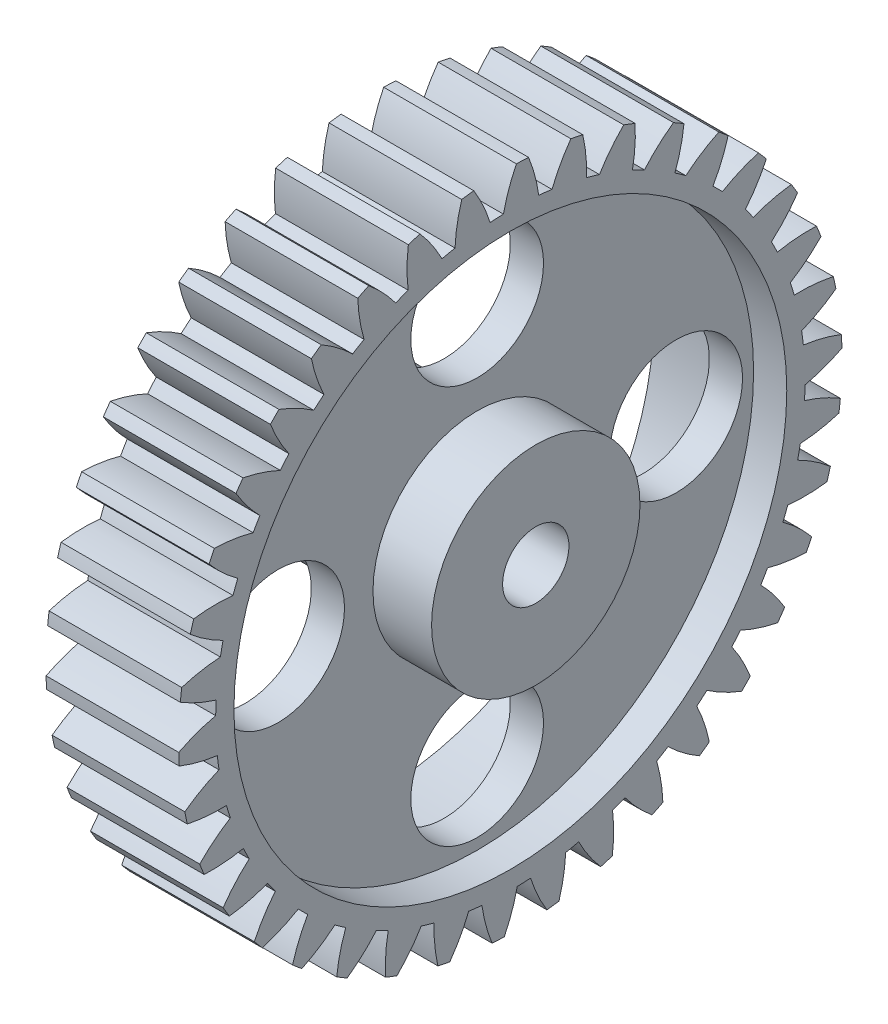
from build123d import *

# Parameters (mm, degrees)
SKETCH1_R                = 6
SKETCH1_R_2              = 3
BOSS_EXTRUDE1_DEPTH      = 12
BOSS_EXTRUDE2_DEPTH      = 2.3
BOSS_EXTRUDE2_DEPTH_BACK = 3
SKETCH2_R                = 9.425
SKETCH2_R_2              = 3
BOSS_EXTRUDE3_DEPTH      = 8.3
BOSS_EXTRUDE3_DEPTH_BACK = 6
SKETCH3_R                = 7.325
SKETCH3_R_2              = 3
CUT_EXTRUDE1_START       = -3
SKETCH4_R                = 25
SKETCH4_R_2              = 9.425
CUT_EXTRUDE1_DEPTH       = 3
SKETCH5_R                = 25
SKETCH5_R_2              = 7.325
CUT_EXTRUDE2_DEPTH       = 6


with BuildPart() as part:
    # Sketch1 → Boss-Extrude1 (new body)
    with BuildSketch(Plane(origin=(0, 0, 0), x_dir=(0, 0, -1), z_dir=(1, 0, 0))):
        with BuildLine():
            ThreePointArc((0.545834956, 29.995033992), (-0.144682898, 28.355188049), (-0.62738395, 26.642614162))
            ThreePointArc((-0.62738395, 26.642614162), (-1.229291333, 26.621632986), (-1.830570879, 26.587055314))
            ThreePointArc((-1.830570879, 26.587055314), (-2.469042312, 28.247857485), (-3.307743856, 29.817089573))
            ThreePointArc((-3.307743856, 29.817089573), (-3.853834567, 29.751436253), (-4.398629852, 29.675782305))
            ThreePointArc((-4.398629852, 29.675782305), (-4.809820172, 27.94464622), (-5.004057412, 26.175979627))
            ThreePointArc((-5.004057412, 26.175979627), (-5.594302175, 26.056213907), (-6.181689754, 25.923140469))
            ThreePointArc((-6.181689754, 25.923140469), (-7.084812322, 27.45620252), (-8.170362183, 28.86598659))
            ThreePointArc((-8.170362183, 28.86598659), (-8.698198747, 28.711345119), (-9.223111504, 28.547052636))
            ThreePointArc((-9.223111504, 28.547052636), (-9.343758089, 26.771847288), (-9.244233233, 24.995332603))
            ThreePointArc((-9.244233233, 24.995332603), (-9.806715037, 24.780049237), (-10.364188247, 24.552109929))
            ThreePointArc((-10.364188247, 24.552109929), (-11.507327121, 25.915613923), (-12.810114328, 27.127494741))
            ThreePointArc((-12.810114328, 27.127494741), (-13.305298739, 26.888083335), (-13.796010717, 26.639633787))
            ThreePointArc((-13.796010717, 26.639633787), (-13.622822643, 24.868782151), (-13.23225047, 23.132878064))
            ThreePointArc((-13.23225047, 23.132878064), (-13.751626278, 22.82794942), (-14.263978703, 22.511361833))
            ThreePointArc((-14.263978703, 22.511361833), (-15.615952033, 23.668114934), (-17.100439947, 24.649035551))
            ThreePointArc((-17.100439947, 24.649035551), (-17.549464867, 24.33138473), (-17.992590721, 24.005555173))
            ThreePointArc((-17.992590721, 24.005555173), (-17.530292107, 22.287361466), (-16.859326407, 20.639418914))
            ThreePointArc((-16.859326407, 20.639418914), (-17.321429001, 20.253162651), (-17.774685002, 19.856562469))
            ThreePointArc((-17.774685002, 19.856562469), (-19.298614482, 20.775011469), (-20.924310142, 21.498214927))
            ThreePointArc((-20.924310142, 21.498214927), (-21.314927341, 21.110989377), (-21.698379753, 20.716667591))
            ThreePointArc((-21.698379753, 20.716667591), (-20.9595809, 19.097999658), (-20.026523869, 17.582970219))
            ThreePointArc((-20.026523869, 17.582970219), (-20.418748294, 17.125922401), (-20.80054423, 16.660127842))
            ThreePointArc((-20.80054423, 16.660127842), (-22.454861035, 17.315219847), (-24.177419703, 17.760979042))
            ThreePointArc((-24.177419703, 17.760979042), (-24.498974161, 17.314741265), (-24.812293549, 16.862683322))
            ThreePointArc((-24.812293549, 16.862683322), (-23.817146964, 15.387694204), (-22.647449965, 14.046903932))
            ThreePointArc((-22.647449965, 14.046903932), (-22.959097362, 13.531531632), (-23.259018835, 13.009248358))
            ThreePointArc((-23.259018835, 13.009248358), (-24.998597514, 13.383114165), (-26.771032279, 13.539269947))
            ThreePointArc((-26.771032279, 13.539269947), (-27.014752829, 13.046192148), (-27.249392658, 12.54872901))
            ThreePointArc((-27.249392658, 12.54872901), (-26.025043346, 11.257652565), (-24.650612664, 10.127674723))
            ThreePointArc((-24.650612664, 10.127674723), (-24.873182104, 9.568035954), (-25.083048037, 9.003510491))
            ThreePointArc((-25.083048037, 9.003510491), (-26.86043742, 9.085952016), (-28.634400882, 8.948244863))
            ThreePointArc((-28.634400882, 8.948244863), (-28.793639463, 8.421776918), (-28.943199369, 7.892478083))
            ThreePointArc((-28.943199369, 7.892478083), (-27.523044387, 6.820531511), (-25.981370908, 5.932188949))
            ThreePointArc((-25.981370908, 5.932188949), (-26.108791278, 5.343549197), (-26.222877076, 4.752180329))
            ThreePointArc((-26.222877076, 4.752180329), (-27.989594613, 4.540948782), (-29.716697673, 4.113134985))
            ThreePointArc((-29.716697673, 4.113134985), (-29.787110672, 3.567637568), (-29.847511051, 3.020940927))
            ThreePointArc((-29.847511051, 3.020940927), (-28.270288525, 2.197364137), (-26.603425083, 1.574888524))
            ThreePointArc((-26.603425083, 1.574888524), (-26.632220686, 0.973304348), (-26.647414385, 0.371223075))
            ThreePointArc((-26.647414385, 0.371223075), (-28.355268629, -0.127919699), (-29.988400417, -0.834170493))
            ThreePointArc((-29.988400417, -0.834170493), (-29.968067151, -1.383817635), (-29.937660437, -1.932999622))
            ThreePointArc((-29.937660437, -1.932999622), (-28.246392887, -2.485741603), (-26.499807171, -2.825370754))
            ThreePointArc((-26.499807171, -2.825370754), (-26.429192538, -3.423489707), (-26.345079695, -4.019860177))
            ThreePointArc((-26.345079695, -4.019860177), (-27.947484832, -4.793298863), (-29.442097772, -5.758721975))
            ThreePointArc((-29.442097772, -5.758721975), (-29.331572879, -6.297525901), (-29.211188489, -6.83421298))
            ThreePointArc((-29.211188489, -6.83421298), (-27.452009284, -7.101042791), (-25.673343599, -7.148561284))
            ThreePointArc((-25.673343599, -7.148561284), (-25.505244914, -7.726899887), (-25.324119908, -8.301292122))
            ThreePointArc((-25.324119908, -8.301292122), (-26.777366504, -9.327929329), (-28.092691449, -10.526190533))
            ThreePointArc((-28.092691449, -10.526190533), (-27.89498976, -11.039454076), (-27.687911467, -11.549006824))
            ThreePointArc((-27.687911467, -11.549006824), (-25.908806429, -11.522646044), (-24.14657814, -11.276757696))
            ThreePointArc((-24.14657814, -11.276757696), (-23.885580696, -11.81954038), (-23.612384144, -12.356286458))
            ThreePointArc((-23.612384144, -12.356286458), (-24.87683142, -13.6081182), (-25.976989736, -15.006532053))
            ThreePointArc((-25.976989736, -15.006532053), (-25.697504038, -15.480254721), (-25.409380396, -15.948773867))
            ThreePointArc((-25.409380396, -15.948773867), (-23.658878875, -15.629941549), (-21.961156974, -15.097353555))
            ThreePointArc((-21.961156974, -15.097353555), (-21.614380102, -15.589774623), (-21.256564094, -16.074233509))
            ThreePointArc((-21.256564094, -16.074233509), (-22.297721225, -17.517113079), (-23.15270346, -19.077534497))
            ThreePointArc((-23.15270346, -19.077534497), (-22.799057393, -19.498794372), (-22.437747666, -19.913499935))
            ThreePointArc((-22.437747666, -19.913499935), (-20.763598779, -19.310892994), (-19.176692694, -18.506132965))
            ThreePointArc((-19.176692694, -18.506132965), (-18.753595563, -18.934760454), (-18.320920387, -19.353717373))
            ThreePointArc((-18.320920387, -19.353717373), (-19.11038732, -20.948286778), (-19.696871788, -22.628151532))
            ThreePointArc((-19.696871788, -22.628151532), (-19.278711896, -22.985457742), (-18.854071671, -23.335037635))
            ThreePointArc((-18.854071671, -23.335037635), (-17.301941834, -22.465093617), (-15.869138228, -21.410113309))
            ThreePointArc((-15.869138228, -21.410113309), (-15.381261824, -21.763255379), (-14.885529731, -22.105282279))
            ThreePointArc((-14.885529731, -22.105282279), (-15.401771866, -23.808045821), (-15.703760799, -25.561531581))
            ThreePointArc((-15.703760799, -25.561531581), (-15.232493394, -25.845137744), (-14.756105749, -26.120056339))
            ThreePointArc((-14.756105749, -26.120056339), (-13.36833302, -25.006505048), (-12.128715038, -23.730081574))
            ThreePointArc((-12.128715038, -23.730081574), (-11.589367358, -23.99810543), (-11.044100628, -24.253872708))
            ThreePointArc((-11.044100628, -24.253872708), (-11.273036225, -26.018383438), (-11.282292153, -27.797659682))
            ThreePointArc((-11.282292153, -27.797659682), (-10.770772181, -27.999829761), (-10.255631728, -28.192587995))
            ThreePointArc((-10.255631728, -28.192587995), (-9.070070929, -26.865804209), (-8.05745212, -25.402755074))
            ThreePointArc((-8.05745212, -25.402755074), (-7.481345162, -25.578349723), (-6.901417249, -25.740880714))
            ThreePointArc((-6.901417249, -25.740880714), (-6.836801542, -27.519007379), (-6.553071987, -29.275540089))
            ThreePointArc((-6.553071987, -29.275540089), (-6.01525238, -29.390759412), (-5.475410809, -29.496099343))
            ThreePointArc((-5.475410809, -29.496099343), (-4.524400947, -27.992274265), (-3.766402912, -26.382507635))
            ThreePointArc((-3.766402912, -26.382507635), (-3.169251373, -26.460883314), (-2.570481198, -26.525744597))
            ThreePointArc((-2.570481198, -26.525744597), (-2.214076736, -28.268984535), (-1.6451011, -29.954860079))
            ThreePointArc((-1.6451011, -29.954860079), (-1.095652174, -29.979985762), (-0.545834956, -29.995033992))
            ThreePointArc((-0.545834956, -29.995033992), (0.144682898, -28.355188049), (0.62738395, -26.642614162))
            ThreePointArc((0.62738395, -26.642614162), (1.229291333, -26.621632986), (1.830570879, -26.587055314))
            ThreePointArc((1.830570879, -26.587055314), (2.469042312, -28.247857485), (3.307743856, -29.817089573))
            ThreePointArc((3.307743856, -29.817089573), (3.853834567, -29.751436253), (4.398629852, -29.675782305))
            ThreePointArc((4.398629852, -29.675782305), (4.809820172, -27.94464622), (5.004057412, -26.175979627))
            ThreePointArc((5.004057412, -26.175979627), (5.594302175, -26.056213907), (6.181689754, -25.923140469))
            ThreePointArc((6.181689754, -25.923140469), (7.084812322, -27.45620252), (8.170362183, -28.86598659))
            ThreePointArc((8.170362183, -28.86598659), (8.698198747, -28.711345119), (9.223111504, -28.547052636))
            ThreePointArc((9.223111504, -28.547052636), (9.343758089, -26.771847288), (9.244233233, -24.995332603))
            ThreePointArc((9.244233233, -24.995332603), (9.806715037, -24.780049237), (10.364188247, -24.552109929))
            ThreePointArc((10.364188247, -24.552109929), (11.507327121, -25.915613923), (12.810114328, -27.127494741))
            ThreePointArc((12.810114328, -27.127494741), (13.305298739, -26.888083335), (13.796010717, -26.639633787))
            ThreePointArc((13.796010717, -26.639633787), (13.622822643, -24.868782151), (13.23225047, -23.132878064))
            ThreePointArc((13.23225047, -23.132878064), (13.751626278, -22.82794942), (14.263978703, -22.511361833))
            ThreePointArc((14.263978703, -22.511361833), (15.615952033, -23.668114934), (17.100439947, -24.649035551))
            ThreePointArc((17.100439947, -24.649035551), (17.549464867, -24.33138473), (17.992590721, -24.005555173))
            ThreePointArc((17.992590721, -24.005555173), (17.530292107, -22.287361466), (16.859326407, -20.639418914))
            ThreePointArc((16.859326407, -20.639418914), (17.321429001, -20.253162651), (17.774685002, -19.856562469))
            ThreePointArc((17.774685002, -19.856562469), (19.298614482, -20.775011469), (20.924310142, -21.498214927))
            ThreePointArc((20.924310142, -21.498214927), (21.314927341, -21.110989377), (21.698379753, -20.716667591))
            ThreePointArc((21.698379753, -20.716667591), (20.9595809, -19.097999658), (20.026523869, -17.582970219))
            ThreePointArc((20.026523869, -17.582970219), (20.418748294, -17.125922401), (20.80054423, -16.660127842))
            ThreePointArc((20.80054423, -16.660127842), (22.454861035, -17.315219847), (24.177419703, -17.760979042))
            ThreePointArc((24.177419703, -17.760979042), (24.498974161, -17.314741265), (24.812293549, -16.862683322))
            ThreePointArc((24.812293549, -16.862683322), (23.817146964, -15.387694204), (22.647449965, -14.046903932))
            ThreePointArc((22.647449965, -14.046903932), (22.959097362, -13.531531632), (23.259018835, -13.009248358))
            ThreePointArc((23.259018835, -13.009248358), (24.998597514, -13.383114165), (26.771032279, -13.539269947))
            ThreePointArc((26.771032279, -13.539269947), (27.014752829, -13.046192148), (27.249392658, -12.54872901))
            ThreePointArc((27.249392658, -12.54872901), (26.025043346, -11.257652565), (24.650612664, -10.127674723))
            ThreePointArc((24.650612664, -10.127674723), (24.873182104, -9.568035954), (25.083048037, -9.003510491))
            ThreePointArc((25.083048037, -9.003510491), (26.86043742, -9.085952016), (28.634400882, -8.948244863))
            ThreePointArc((28.634400882, -8.948244863), (28.793639463, -8.421776918), (28.943199369, -7.892478083))
            ThreePointArc((28.943199369, -7.892478083), (27.523044387, -6.820531511), (25.981370908, -5.932188949))
            ThreePointArc((25.981370908, -5.932188949), (26.108791278, -5.343549197), (26.222877076, -4.752180329))
            ThreePointArc((26.222877076, -4.752180329), (27.989594613, -4.540948782), (29.716697673, -4.113134985))
            ThreePointArc((29.716697673, -4.113134985), (29.787110672, -3.567637568), (29.847511051, -3.020940927))
            ThreePointArc((29.847511051, -3.020940927), (28.270288525, -2.197364137), (26.603425083, -1.574888524))
            ThreePointArc((26.603425083, -1.574888524), (26.632220686, -0.973304348), (26.647414385, -0.371223075))
            ThreePointArc((26.647414385, -0.371223075), (28.355268629, 0.127919699), (29.988400417, 0.834170493))
            ThreePointArc((29.988400417, 0.834170493), (29.968067151, 1.383817635), (29.937660437, 1.932999622))
            ThreePointArc((29.937660437, 1.932999622), (28.246392887, 2.485741603), (26.499807171, 2.825370754))
            ThreePointArc((26.499807171, 2.825370754), (26.429192538, 3.423489707), (26.345079695, 4.019860177))
            ThreePointArc((26.345079695, 4.019860177), (27.947484832, 4.793298863), (29.442097772, 5.758721975))
            ThreePointArc((29.442097772, 5.758721975), (29.331572879, 6.297525901), (29.211188489, 6.83421298))
            ThreePointArc((29.211188489, 6.83421298), (27.452009284, 7.101042791), (25.673343599, 7.148561284))
            ThreePointArc((25.673343599, 7.148561284), (25.505244914, 7.726899887), (25.324119908, 8.301292122))
            ThreePointArc((25.324119908, 8.301292122), (26.777366504, 9.327929329), (28.092691449, 10.526190533))
            ThreePointArc((28.092691449, 10.526190533), (27.89498976, 11.039454076), (27.687911467, 11.549006824))
            ThreePointArc((27.687911467, 11.549006824), (25.908806429, 11.522646044), (24.14657814, 11.276757696))
            ThreePointArc((24.14657814, 11.276757696), (23.885580696, 11.81954038), (23.612384144, 12.356286458))
            ThreePointArc((23.612384144, 12.356286458), (24.87683142, 13.6081182), (25.976989736, 15.006532053))
            ThreePointArc((25.976989736, 15.006532053), (25.697504038, 15.480254721), (25.409380396, 15.948773867))
            ThreePointArc((25.409380396, 15.948773867), (23.658878875, 15.629941549), (21.961156974, 15.097353555))
            ThreePointArc((21.961156974, 15.097353555), (21.614380102, 15.589774623), (21.256564094, 16.074233509))
            ThreePointArc((21.256564094, 16.074233509), (22.297721225, 17.517113079), (23.15270346, 19.077534497))
            ThreePointArc((23.15270346, 19.077534497), (22.799057393, 19.498794372), (22.437747666, 19.913499935))
            ThreePointArc((22.437747666, 19.913499935), (20.763598779, 19.310892994), (19.176692694, 18.506132965))
            ThreePointArc((19.176692694, 18.506132965), (18.753595563, 18.934760454), (18.320920387, 19.353717373))
            ThreePointArc((18.320920387, 19.353717373), (19.11038732, 20.948286778), (19.696871788, 22.628151532))
            ThreePointArc((19.696871788, 22.628151532), (19.278711896, 22.985457742), (18.854071671, 23.335037635))
            ThreePointArc((18.854071671, 23.335037635), (17.301941834, 22.465093617), (15.869138228, 21.410113309))
            ThreePointArc((15.869138228, 21.410113309), (15.381261824, 21.763255379), (14.885529731, 22.105282279))
            ThreePointArc((14.885529731, 22.105282279), (15.401771866, 23.808045821), (15.703760799, 25.561531581))
            ThreePointArc((15.703760799, 25.561531581), (15.232493394, 25.845137744), (14.756105749, 26.120056339))
            ThreePointArc((14.756105749, 26.120056339), (13.36833302, 25.006505048), (12.128715038, 23.730081574))
            ThreePointArc((12.128715038, 23.730081574), (11.589367358, 23.99810543), (11.044100628, 24.253872708))
            ThreePointArc((11.044100628, 24.253872708), (11.273036225, 26.018383438), (11.282292153, 27.797659682))
            ThreePointArc((11.282292153, 27.797659682), (10.770772181, 27.999829761), (10.255631728, 28.192587995))
            ThreePointArc((10.255631728, 28.192587995), (9.070070929, 26.865804209), (8.05745212, 25.402755074))
            ThreePointArc((8.05745212, 25.402755074), (7.481345162, 25.578349723), (6.901417249, 25.740880714))
            ThreePointArc((6.901417249, 25.740880714), (6.836801542, 27.519007379), (6.553071987, 29.275540089))
            ThreePointArc((6.553071987, 29.275540089), (6.01525238, 29.390759412), (5.475410809, 29.496099343))
            ThreePointArc((5.475410809, 29.496099343), (4.524400947, 27.992274265), (3.766402912, 26.382507635))
            ThreePointArc((3.766402912, 26.382507635), (3.169251373, 26.460883314), (2.570481198, 26.525744597))
            ThreePointArc((2.570481198, 26.525744597), (2.214076736, 28.268984535), (1.6451011, 29.954860079))
            ThreePointArc((1.6451011, 29.954860079), (1.095652174, 29.979985762), (0.545834956, 29.995033992))
        make_face()
        with Locations((18, 0)):
            Circle(SKETCH1_R, mode=Mode.SUBTRACT)
        with Locations((-18, 0)):
            Circle(SKETCH1_R, mode=Mode.SUBTRACT)
        with Locations((0, -18)):
            Circle(SKETCH1_R, mode=Mode.SUBTRACT)
        Circle(SKETCH1_R_2, mode=Mode.SUBTRACT)
        with Locations((0, 18)):
            Circle(SKETCH1_R, mode=Mode.SUBTRACT)
    extrude(amount=BOSS_EXTRUDE1_DEPTH)

    # Sketch2 → Boss-Extrude2 (add, two sides: drawn at the far end of the back side and taken through both)
    with BuildSketch(Plane(origin=(12, 0, 0), x_dir=(0, 0, -1), z_dir=(1, 0, 0)).offset(-BOSS_EXTRUDE2_DEPTH_BACK)):
        Circle(SKETCH2_R)
        Circle(SKETCH2_R_2, mode=Mode.SUBTRACT)
    extrude(amount=BOSS_EXTRUDE2_DEPTH + BOSS_EXTRUDE2_DEPTH_BACK)

    # Sketch3 → Boss-Extrude3 (add, two sides: drawn at the far end of the back side and taken through both)
    with BuildSketch(Plane.ZY.offset(-BOSS_EXTRUDE3_DEPTH_BACK)):
        Circle(SKETCH3_R)
        Circle(SKETCH3_R_2, mode=Mode.SUBTRACT)
    extrude(amount=BOSS_EXTRUDE3_DEPTH + BOSS_EXTRUDE3_DEPTH_BACK)

    # Sketch4 → Cut-Extrude1 (cut)
    with BuildSketch(Plane(origin=(12, 0, 0), x_dir=(0, 0, -1), z_dir=(1, 0, 0)).offset(CUT_EXTRUDE1_START)):
        Circle(SKETCH4_R)
        Circle(SKETCH4_R_2, mode=Mode.SUBTRACT)
    extrude(amount=CUT_EXTRUDE1_DEPTH, mode=Mode.SUBTRACT)

    # Sketch5 → Cut-Extrude2 (cut)
    with BuildSketch(Plane.ZY):
        Circle(SKETCH5_R)
        Circle(SKETCH5_R_2, mode=Mode.SUBTRACT)
    extrude(amount=-CUT_EXTRUDE2_DEPTH, mode=Mode.SUBTRACT)


solid = part.part
